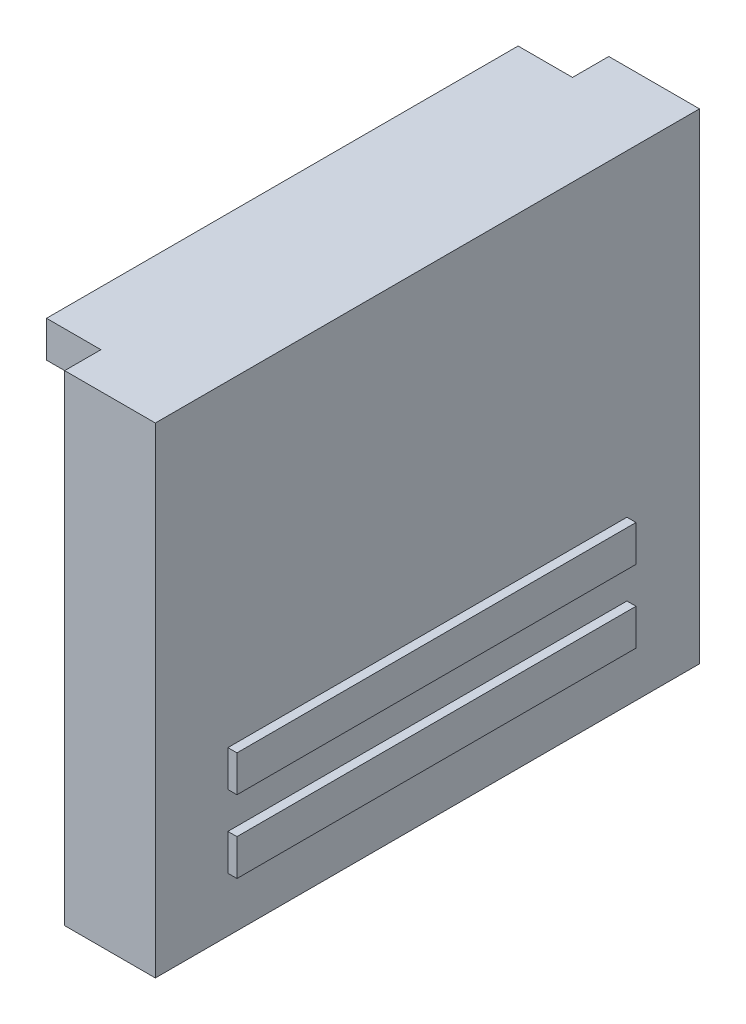
from build123d import *

# Parameters (mm, degrees)
SKETCH1_W           = 30
SKETCH1_H           = 26.5
BOSS_EXTRUDE1_DEPTH = 2.5
SKETCH2_W           = 22
SKETCH2_H           = 2
BOSS_EXTRUDE2_DEPTH = 0.5
SKETCH3_W           = 26
SKETCH3_H           = 2
BOSS_EXTRUDE3_DEPTH = 1.5
SKETCH4_R           = 2
BOSS_EXTRUDE4_DEPTH = 2.5


with BuildPart() as part:
    # Sketch1 → Boss-Extrude1 (new, symmetric)
    with BuildSketch(Plane(origin=(181, 0, 0), x_dir=(0, 0, -1), z_dir=(1, 0, 0))):
        with Locations((-149, 50.25)):
            Rectangle(SKETCH1_W, SKETCH1_H)
    extrude(amount=BOSS_EXTRUDE1_DEPTH, both=True)

    # Sketch2 → Boss-Extrude2 (add, symmetric)
    with BuildSketch(Plane(origin=(183.5, 0, 0), x_dir=(0, 0, -1), z_dir=(1, 0, 0))):
        with Locations((-149, 41)):
            Rectangle(SKETCH2_W, SKETCH2_H)
        with Locations((-149, 45)):
            Rectangle(SKETCH2_W, SKETCH2_H)
    extrude(amount=BOSS_EXTRUDE2_DEPTH, both=True)

    # Sketch3 → Boss-Extrude3 (add, symmetric)
    with BuildSketch(Plane(origin=(177, 0, 0), x_dir=(0, 0, -1), z_dir=(1, 0, 0))):
        with Locations((-149, 62.5)):
            Rectangle(SKETCH3_W, SKETCH3_H)
    extrude(amount=BOSS_EXTRUDE3_DEPTH, both=True)

    # Sketch4 → Boss-Extrude4 (add, symmetric)
    with BuildSketch(Plane(origin=(176, 0, 0), x_dir=(0, 0, -1), z_dir=(1, 0, 0))):
        with Locations((-149, 43)):
            Circle(SKETCH4_R)
    extrude(amount=BOSS_EXTRUDE4_DEPTH, both=True)


solid = part.part
